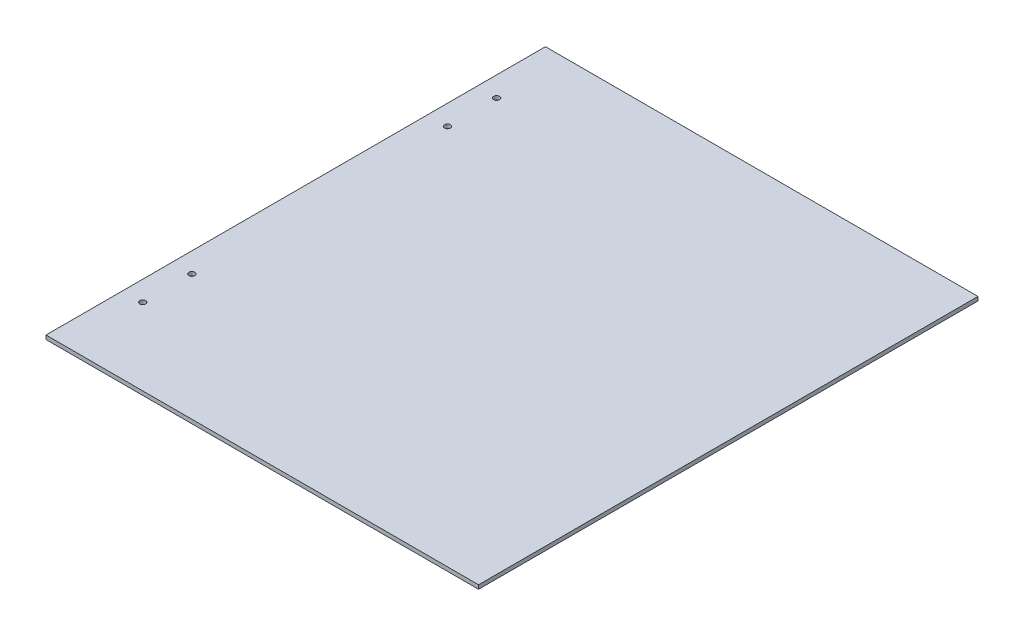
from build123d import *

# Parameters (mm, degrees)
SKETCH1_W               = 220
SKETCH1_H               = 254
BASE_FLANGE1_DEPTH      = 2
ADVANCEDHOLE2_START     = -2
ADVANCEDHOLE2_OUTLINE_R = 1.5
ADVANCEDHOLE2_DEPTH     = 2


# Read off the part's stored shape, not the designer's step: AdvancedHole2
# Sheet-metal steps are written as plain solids
with BuildPart() as part:
    # Sketch1 → Base-Flange1 (new body)
    with BuildSketch(Plane(origin=(0, 0, 0), x_dir=(1, 0, 0), z_dir=(0, 1, 0))):
        with Locations((-14.757070341, -56.485134155)):
            Rectangle(SKETCH1_W, SKETCH1_H)
    extrude(amount=-BASE_FLANGE1_DEPTH)

    # AdvancedHole2 outline → AdvancedHole2 (cut)
    with BuildSketch(Plane(origin=(0, 0, 0), x_dir=(1, 0, 0), z_dir=(0, 1, 0)).offset(ADVANCEDHOLE2_START)):
        with Locations((-114.564799313, -144.485134155)):
            Circle(ADVANCEDHOLE2_OUTLINE_R)
        with Locations((-114.564799313, -119.485134155)):
            Circle(ADVANCEDHOLE2_OUTLINE_R)
        with Locations((-114.564799313, 10.514865845)):
            Circle(ADVANCEDHOLE2_OUTLINE_R)
        with Locations((-114.564799313, 35.514865845)):
            Circle(ADVANCEDHOLE2_OUTLINE_R)
    extrude(amount=ADVANCEDHOLE2_DEPTH, mode=Mode.SUBTRACT)


solid = part.part
